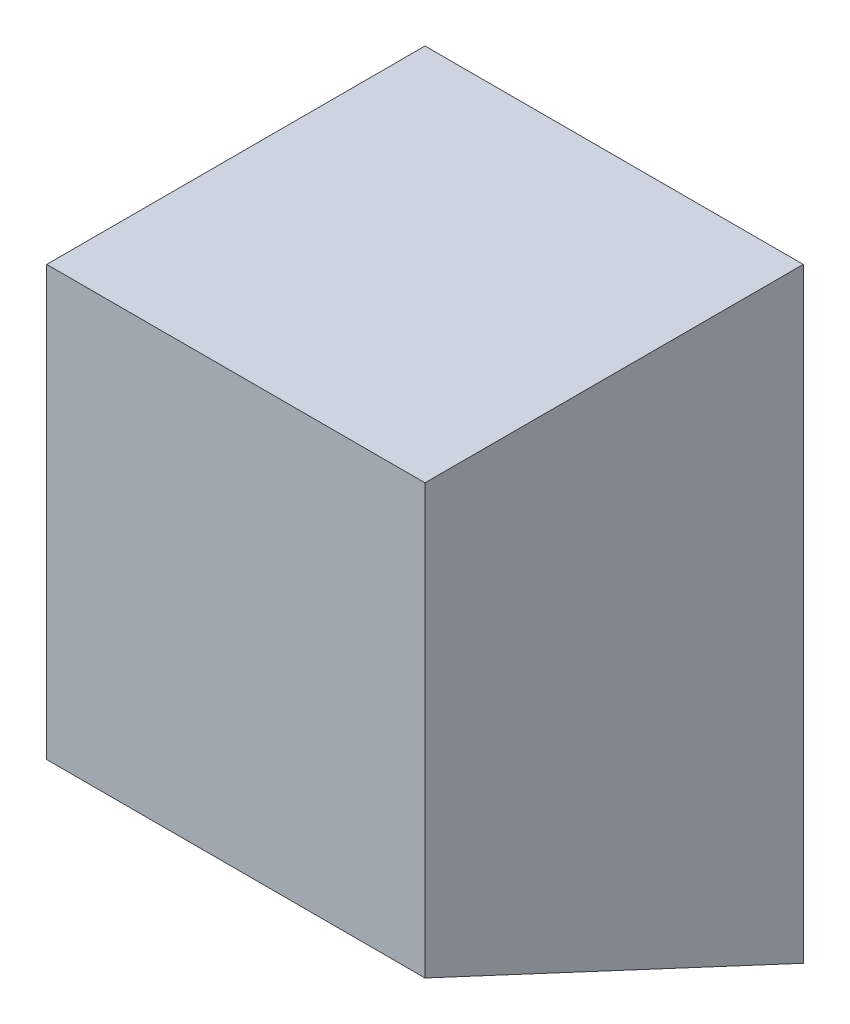
from build123d import *

# Parameters (mm, degrees)
SKETCH1_W           = 25
SKETCH1_H           = 25
BOSS_EXTRUDE1_DEPTH = 40
CUT_EXTRUDE1_DEPTH  = 40


with BuildPart() as part:
    # Sketch1 → Boss-Extrude1 (new body)
    with BuildSketch(Plane(origin=(0, 0, 0), x_dir=(1, 0, 0), z_dir=(0, 1, 0))):
        with Locations((-64.404761905, 3.571428571)):
            Rectangle(SKETCH1_W, SKETCH1_H)
    extrude(amount=BOSS_EXTRUDE1_DEPTH)

    # Sketch2 → Cut-Extrude1 (cut)
    with BuildSketch(Plane(origin=(-51.904761905, 0, 0), x_dir=(0, 0, -1), z_dir=(1, 0, 0))):
        Polygon((16.071428571, 0), (-8.928571429, 0), (-8.928571429, 11.657691454), align=None)
    extrude(amount=-CUT_EXTRUDE1_DEPTH, mode=Mode.SUBTRACT)


solid = part.part
